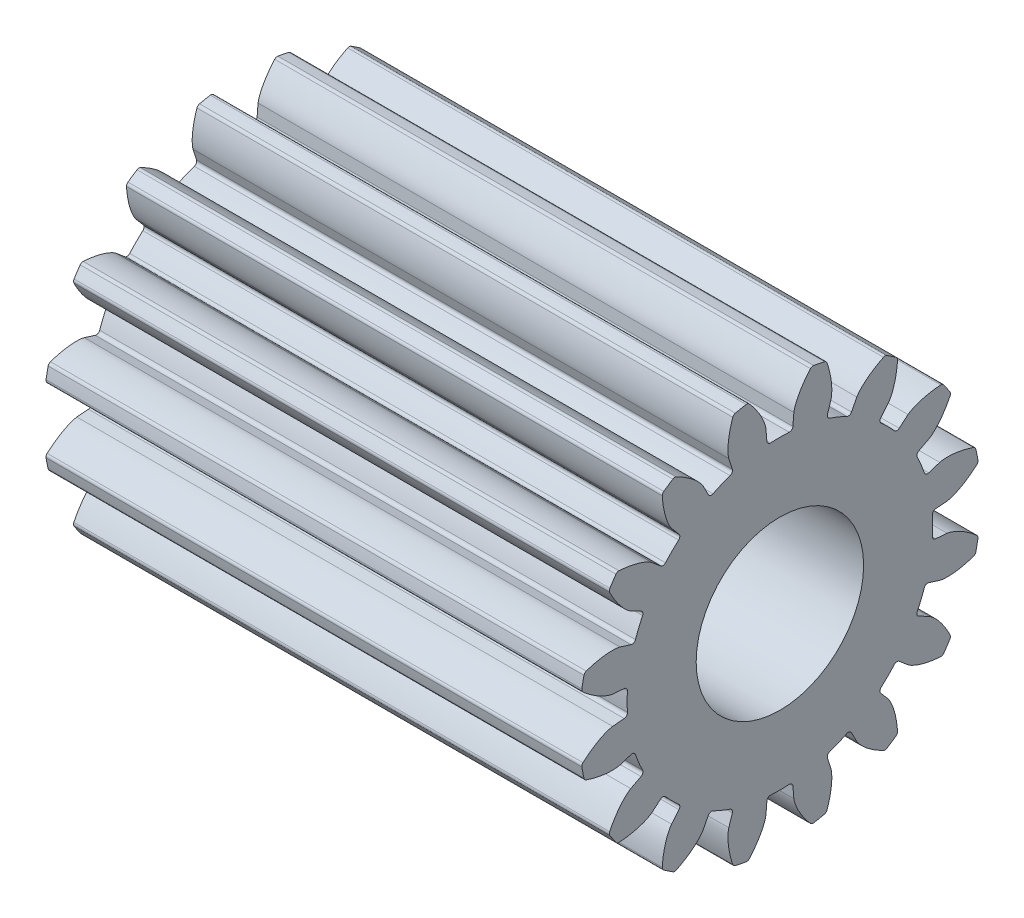
from build123d import *

# Parameters (mm, degrees)
SKETCH2_R                      = 9.525
SKETCH2_R_2                    = 3.96875
GEAR_WIDTH_EXTRUDE_DEPTH       = 25.4
GEAR_TOOTH_CUT_DEPTH           = 25.4
TOOTH_FILLETS_R                = 0.166158333
CIRPATTERN1_COUNT              = 16
CIRPATTERN1_COPY_1_DEPTH       = 25.4
CIRPATTERN1_COPY_2_DEPTH       = 25.4
CIRPATTERN1_COPY_3_DEPTH       = 25.4
CIRPATTERN1_COPY_4_DEPTH       = 25.4
CIRPATTERN1_COPY_5_DEPTH       = 25.4
CIRPATTERN1_COPY_6_DEPTH       = 25.4
CIRPATTERN1_COPY_7_DEPTH       = 25.4
CIRPATTERN1_COPY_8_DEPTH       = 25.4
CIRPATTERN1_COPY_9_DEPTH       = 25.4
CIRPATTERN1_COPY_10_DEPTH      = 25.4
CIRPATTERN1_COPY_11_DEPTH      = 25.4
CIRPATTERN1_COPY_12_DEPTH      = 25.4
CIRPATTERN1_COPY_13_DEPTH      = 25.4
CIRPATTERN1_COPY_14_DEPTH      = 25.4
CIRPATTERN1_COPY_15_DEPTH      = 25.4
TOOTH_FILLETS_OF_CIRPATTERN1_R = 0.166158333


with BuildPart() as part:
    # Sketch2 → Gear Width Extrude (new body)
    with BuildSketch(Plane.YZ):
        Circle(SKETCH2_R)
        Circle(SKETCH2_R_2, mode=Mode.SUBTRACT)
    extrude(amount=GEAR_WIDTH_EXTRUDE_DEPTH)

    # Sketch3 → Gear Tooth Cut (cut)
    with BuildSketch(Plane.YZ):
        with BuildLine():
            ThreePointArc((7.217081039, 0.602362023), (7.23589879, 0.301442247), (7.242175, 0))
            Line((7.242175, 0), (9.525, 0))
            ThreePointArc((9.525, 0), (9.494777011, 0.758178416), (9.40429984, 1.511545405))
            add(Edge.make_bspline(
                [(7.92849662, 0.661739176), (7.931033412, 0.661986521), (7.938137755, 0.662789667), (7.960006234, 0.665975561), (8.00289467, 0.674240792), (8.055417038, 0.687277699), (8.115325958, 0.704960105), (8.172704771, 0.724134336), (8.221473162, 0.74183102), (8.269833879, 0.760691719), (8.317737193, 0.780565767), (8.375423353, 0.805916371), (8.444109409, 0.838085472), (8.523635746, 0.878248138), (8.612898724, 0.926808518), (8.702807913, 0.979487909), (8.790380894, 1.033935241), (8.877764367, 1.091915859), (8.961530307, 1.150117227), (9.047335874, 1.213569409), (9.125932899, 1.273668216), (9.212588483, 1.34427632), (9.282116998, 1.402218266), (9.352724099, 1.464773247), (9.386907426, 1.495616144), (9.40429984, 1.511545405)],
                knots=[0, 0, 0, 0, 0, 0.005376749, 0.015083688, 0.04661014, 0.092110526, 0.119476176, 0.146842496, 0.174208854, 0.201574956, 0.228941013, 0.256307345, 0.307035032, 0.361767352, 0.416499661, 0.471231937, 0.525964282, 0.580696616, 0.635428982, 0.690161387, 0.744893688, 0.799626082, 0.854358408, 0.909090915, 0.909090915, 0.909090915, 0.909090915, 0.909090915], degree=4))
            Line((7.92849662, 0.661739176), (7.217081039, 0.602362023))
        make_face()
    gear_tooth_cut = extrude(amount=GEAR_TOOTH_CUT_DEPTH, mode=Mode.SUBTRACT)

    # Gear Tooth Cut Mirror: Gear Tooth Cut across plane
    add(gear_tooth_cut.mirror(Plane(origin=(25.4, 0, 0), x_dir=(1, 0, 0), z_dir=(0, 0, 1))), mode=Mode.SUBTRACT)

    # Tooth Fillets
    tooth_fillets_edges = [part.edges().sort_by_distance(p)[0] for p in [
        (12.7, 9.40429984, 1.511545405),
        (12.7, 9.40429984, -1.511545405),
        (12.7, 7.217081039, 0.602362023),
        (12.7, 7.217081039, -0.602362023),
    ]]
    fillet(tooth_fillets_edges, radius=TOOTH_FILLETS_R)

    # CirPattern1: Gear Tooth Cut ×16 about axis
    cirpattern1_axis = Axis((0, 0, 0), (1, 0, 0))
    for i in range(1, CIRPATTERN1_COUNT):
        add(gear_tooth_cut.rotate(cirpattern1_axis, i * 360 / CIRPATTERN1_COUNT), mode=Mode.SUBTRACT)

    # CirPattern1 copy 1 sketch → CirPattern1 copy 1 (cut)
    with BuildSketch(Plane(origin=(0, 0, 0), x_dir=(0, 0.9238795325112867, 0.3826834323650898), z_dir=(1, 0, 0))):
        with BuildLine():
            ThreePointArc((7.217081039, -0.602362023), (7.23589879, -0.301442247), (7.242175, 0))
            Line((7.242175, 0), (9.525, 0))
            ThreePointArc((9.525, 0), (9.494777011, -0.758178416), (9.40429984, -1.511545405))
            add(Edge.make_bspline(
                [(7.92849662, -0.661739176), (7.931033412, -0.661986521), (7.938137755, -0.662789667), (7.960006234, -0.665975561), (8.00289467, -0.674240792), (8.055417038, -0.687277699), (8.115325958, -0.704960105), (8.172704771, -0.724134336), (8.221473162, -0.74183102), (8.269833879, -0.760691719), (8.317737193, -0.780565767), (8.375423353, -0.805916371), (8.444109409, -0.838085472), (8.523635746, -0.878248138), (8.612898724, -0.926808518), (8.702807913, -0.979487909), (8.790380894, -1.033935241), (8.877764367, -1.091915859), (8.961530307, -1.150117227), (9.047335874, -1.213569409), (9.125932899, -1.273668216), (9.212588483, -1.34427632), (9.282116998, -1.402218266), (9.352724099, -1.464773247), (9.386907426, -1.495616144), (9.40429984, -1.511545405)],
                knots=[0, 0, 0, 0, 0, 0.005376749, 0.015083688, 0.04661014, 0.092110526, 0.119476176, 0.146842496, 0.174208854, 0.201574956, 0.228941013, 0.256307345, 0.307035032, 0.361767352, 0.416499661, 0.471231937, 0.525964282, 0.580696616, 0.635428982, 0.690161387, 0.744893688, 0.799626082, 0.854358408, 0.909090915, 0.909090915, 0.909090915, 0.909090915, 0.909090915], degree=4))
            Line((7.92849662, -0.661739176), (7.217081039, -0.602362023))
        make_face()
    extrude(amount=CIRPATTERN1_COPY_1_DEPTH, mode=Mode.SUBTRACT)

    # CirPattern1 copy 2 sketch → CirPattern1 copy 2 (cut)
    with BuildSketch(Plane(origin=(0, 0, 0), x_dir=(0, 0.7071067811865476, 0.7071067811865475), z_dir=(1, 0, 0))):
        with BuildLine():
            ThreePointArc((7.217081039, -0.602362023), (7.23589879, -0.301442247), (7.242175, 0))
            Line((7.242175, 0), (9.525, 0))
            ThreePointArc((9.525, 0), (9.494777011, -0.758178416), (9.40429984, -1.511545405))
            add(Edge.make_bspline(
                [(7.92849662, -0.661739176), (7.931033412, -0.661986521), (7.938137755, -0.662789667), (7.960006234, -0.665975561), (8.00289467, -0.674240792), (8.055417038, -0.687277699), (8.115325958, -0.704960105), (8.172704771, -0.724134336), (8.221473162, -0.74183102), (8.269833879, -0.760691719), (8.317737193, -0.780565767), (8.375423353, -0.805916371), (8.444109409, -0.838085472), (8.523635746, -0.878248138), (8.612898724, -0.926808518), (8.702807913, -0.979487909), (8.790380894, -1.033935241), (8.877764367, -1.091915859), (8.961530307, -1.150117227), (9.047335874, -1.213569409), (9.125932899, -1.273668216), (9.212588483, -1.34427632), (9.282116998, -1.402218266), (9.352724099, -1.464773247), (9.386907426, -1.495616144), (9.40429984, -1.511545405)],
                knots=[0, 0, 0, 0, 0, 0.005376749, 0.015083688, 0.04661014, 0.092110526, 0.119476176, 0.146842496, 0.174208854, 0.201574956, 0.228941013, 0.256307345, 0.307035032, 0.361767352, 0.416499661, 0.471231937, 0.525964282, 0.580696616, 0.635428982, 0.690161387, 0.744893688, 0.799626082, 0.854358408, 0.909090915, 0.909090915, 0.909090915, 0.909090915, 0.909090915], degree=4))
            Line((7.92849662, -0.661739176), (7.217081039, -0.602362023))
        make_face()
    extrude(amount=CIRPATTERN1_COPY_2_DEPTH, mode=Mode.SUBTRACT)

    # CirPattern1 copy 3 sketch → CirPattern1 copy 3 (cut)
    with BuildSketch(Plane(origin=(0, 0, 0), x_dir=(0, 0.38268343236508984, 0.9238795325112867), z_dir=(1, 0, 0))):
        with BuildLine():
            ThreePointArc((7.217081039, -0.602362023), (7.23589879, -0.301442247), (7.242175, 0))
            Line((7.242175, 0), (9.525, 0))
            ThreePointArc((9.525, 0), (9.494777011, -0.758178416), (9.40429984, -1.511545405))
            add(Edge.make_bspline(
                [(7.92849662, -0.661739176), (7.931033412, -0.661986521), (7.938137755, -0.662789667), (7.960006234, -0.665975561), (8.00289467, -0.674240792), (8.055417038, -0.687277699), (8.115325958, -0.704960105), (8.172704771, -0.724134336), (8.221473162, -0.74183102), (8.269833879, -0.760691719), (8.317737193, -0.780565767), (8.375423353, -0.805916371), (8.444109409, -0.838085472), (8.523635746, -0.878248138), (8.612898724, -0.926808518), (8.702807913, -0.979487909), (8.790380894, -1.033935241), (8.877764367, -1.091915859), (8.961530307, -1.150117227), (9.047335874, -1.213569409), (9.125932899, -1.273668216), (9.212588483, -1.34427632), (9.282116998, -1.402218266), (9.352724099, -1.464773247), (9.386907426, -1.495616144), (9.40429984, -1.511545405)],
                knots=[0, 0, 0, 0, 0, 0.005376749, 0.015083688, 0.04661014, 0.092110526, 0.119476176, 0.146842496, 0.174208854, 0.201574956, 0.228941013, 0.256307345, 0.307035032, 0.361767352, 0.416499661, 0.471231937, 0.525964282, 0.580696616, 0.635428982, 0.690161387, 0.744893688, 0.799626082, 0.854358408, 0.909090915, 0.909090915, 0.909090915, 0.909090915, 0.909090915], degree=4))
            Line((7.92849662, -0.661739176), (7.217081039, -0.602362023))
        make_face()
    extrude(amount=CIRPATTERN1_COPY_3_DEPTH, mode=Mode.SUBTRACT)

    # CirPattern1 copy 4 sketch → CirPattern1 copy 4 (cut)
    with BuildSketch(Plane(origin=(0, 0, 0), x_dir=(0, 0, 1), z_dir=(1, 0, 0))):
        with BuildLine():
            ThreePointArc((7.217081039, -0.602362023), (7.23589879, -0.301442247), (7.242175, 0))
            Line((7.242175, 0), (9.525, 0))
            ThreePointArc((9.525, 0), (9.494777011, -0.758178416), (9.40429984, -1.511545405))
            add(Edge.make_bspline(
                [(7.92849662, -0.661739176), (7.931033412, -0.661986521), (7.938137755, -0.662789667), (7.960006234, -0.665975561), (8.00289467, -0.674240792), (8.055417038, -0.687277699), (8.115325958, -0.704960105), (8.172704771, -0.724134336), (8.221473162, -0.74183102), (8.269833879, -0.760691719), (8.317737193, -0.780565767), (8.375423353, -0.805916371), (8.444109409, -0.838085472), (8.523635746, -0.878248138), (8.612898724, -0.926808518), (8.702807913, -0.979487909), (8.790380894, -1.033935241), (8.877764367, -1.091915859), (8.961530307, -1.150117227), (9.047335874, -1.213569409), (9.125932899, -1.273668216), (9.212588483, -1.34427632), (9.282116998, -1.402218266), (9.352724099, -1.464773247), (9.386907426, -1.495616144), (9.40429984, -1.511545405)],
                knots=[0, 0, 0, 0, 0, 0.005376749, 0.015083688, 0.04661014, 0.092110526, 0.119476176, 0.146842496, 0.174208854, 0.201574956, 0.228941013, 0.256307345, 0.307035032, 0.361767352, 0.416499661, 0.471231937, 0.525964282, 0.580696616, 0.635428982, 0.690161387, 0.744893688, 0.799626082, 0.854358408, 0.909090915, 0.909090915, 0.909090915, 0.909090915, 0.909090915], degree=4))
            Line((7.92849662, -0.661739176), (7.217081039, -0.602362023))
        make_face()
    extrude(amount=CIRPATTERN1_COPY_4_DEPTH, mode=Mode.SUBTRACT)

    # CirPattern1 copy 5 sketch → CirPattern1 copy 5 (cut)
    with BuildSketch(Plane(origin=(0, 0, 0), x_dir=(0, -0.3826834323650897, 0.9238795325112867), z_dir=(1, 0, 0))):
        with BuildLine():
            ThreePointArc((7.217081039, -0.602362023), (7.23589879, -0.301442247), (7.242175, 0))
            Line((7.242175, 0), (9.525, 0))
            ThreePointArc((9.525, 0), (9.494777011, -0.758178416), (9.40429984, -1.511545405))
            add(Edge.make_bspline(
                [(7.92849662, -0.661739176), (7.931033412, -0.661986521), (7.938137755, -0.662789667), (7.960006234, -0.665975561), (8.00289467, -0.674240792), (8.055417038, -0.687277699), (8.115325958, -0.704960105), (8.172704771, -0.724134336), (8.221473162, -0.74183102), (8.269833879, -0.760691719), (8.317737193, -0.780565767), (8.375423353, -0.805916371), (8.444109409, -0.838085472), (8.523635746, -0.878248138), (8.612898724, -0.926808518), (8.702807913, -0.979487909), (8.790380894, -1.033935241), (8.877764367, -1.091915859), (8.961530307, -1.150117227), (9.047335874, -1.213569409), (9.125932899, -1.273668216), (9.212588483, -1.34427632), (9.282116998, -1.402218266), (9.352724099, -1.464773247), (9.386907426, -1.495616144), (9.40429984, -1.511545405)],
                knots=[0, 0, 0, 0, 0, 0.005376749, 0.015083688, 0.04661014, 0.092110526, 0.119476176, 0.146842496, 0.174208854, 0.201574956, 0.228941013, 0.256307345, 0.307035032, 0.361767352, 0.416499661, 0.471231937, 0.525964282, 0.580696616, 0.635428982, 0.690161387, 0.744893688, 0.799626082, 0.854358408, 0.909090915, 0.909090915, 0.909090915, 0.909090915, 0.909090915], degree=4))
            Line((7.92849662, -0.661739176), (7.217081039, -0.602362023))
        make_face()
    extrude(amount=CIRPATTERN1_COPY_5_DEPTH, mode=Mode.SUBTRACT)

    # CirPattern1 copy 6 sketch → CirPattern1 copy 6 (cut)
    with BuildSketch(Plane(origin=(0, 0, 0), x_dir=(0, -0.7071067811865475, 0.7071067811865476), z_dir=(1, 0, 0))):
        with BuildLine():
            ThreePointArc((7.217081039, -0.602362023), (7.23589879, -0.301442247), (7.242175, 0))
            Line((7.242175, 0), (9.525, 0))
            ThreePointArc((9.525, 0), (9.494777011, -0.758178416), (9.40429984, -1.511545405))
            add(Edge.make_bspline(
                [(7.92849662, -0.661739176), (7.931033412, -0.661986521), (7.938137755, -0.662789667), (7.960006234, -0.665975561), (8.00289467, -0.674240792), (8.055417038, -0.687277699), (8.115325958, -0.704960105), (8.172704771, -0.724134336), (8.221473162, -0.74183102), (8.269833879, -0.760691719), (8.317737193, -0.780565767), (8.375423353, -0.805916371), (8.444109409, -0.838085472), (8.523635746, -0.878248138), (8.612898724, -0.926808518), (8.702807913, -0.979487909), (8.790380894, -1.033935241), (8.877764367, -1.091915859), (8.961530307, -1.150117227), (9.047335874, -1.213569409), (9.125932899, -1.273668216), (9.212588483, -1.34427632), (9.282116998, -1.402218266), (9.352724099, -1.464773247), (9.386907426, -1.495616144), (9.40429984, -1.511545405)],
                knots=[0, 0, 0, 0, 0, 0.005376749, 0.015083688, 0.04661014, 0.092110526, 0.119476176, 0.146842496, 0.174208854, 0.201574956, 0.228941013, 0.256307345, 0.307035032, 0.361767352, 0.416499661, 0.471231937, 0.525964282, 0.580696616, 0.635428982, 0.690161387, 0.744893688, 0.799626082, 0.854358408, 0.909090915, 0.909090915, 0.909090915, 0.909090915, 0.909090915], degree=4))
            Line((7.92849662, -0.661739176), (7.217081039, -0.602362023))
        make_face()
    extrude(amount=CIRPATTERN1_COPY_6_DEPTH, mode=Mode.SUBTRACT)

    # CirPattern1 copy 7 sketch → CirPattern1 copy 7 (cut)
    with BuildSketch(Plane(origin=(0, 0, 0), x_dir=(0, -0.9238795325112867, 0.3826834323650899), z_dir=(1, 0, 0))):
        with BuildLine():
            ThreePointArc((7.217081039, -0.602362023), (7.23589879, -0.301442247), (7.242175, 0))
            Line((7.242175, 0), (9.525, 0))
            ThreePointArc((9.525, 0), (9.494777011, -0.758178416), (9.40429984, -1.511545405))
            add(Edge.make_bspline(
                [(7.92849662, -0.661739176), (7.931033412, -0.661986521), (7.938137755, -0.662789667), (7.960006234, -0.665975561), (8.00289467, -0.674240792), (8.055417038, -0.687277699), (8.115325958, -0.704960105), (8.172704771, -0.724134336), (8.221473162, -0.74183102), (8.269833879, -0.760691719), (8.317737193, -0.780565767), (8.375423353, -0.805916371), (8.444109409, -0.838085472), (8.523635746, -0.878248138), (8.612898724, -0.926808518), (8.702807913, -0.979487909), (8.790380894, -1.033935241), (8.877764367, -1.091915859), (8.961530307, -1.150117227), (9.047335874, -1.213569409), (9.125932899, -1.273668216), (9.212588483, -1.34427632), (9.282116998, -1.402218266), (9.352724099, -1.464773247), (9.386907426, -1.495616144), (9.40429984, -1.511545405)],
                knots=[0, 0, 0, 0, 0, 0.005376749, 0.015083688, 0.04661014, 0.092110526, 0.119476176, 0.146842496, 0.174208854, 0.201574956, 0.228941013, 0.256307345, 0.307035032, 0.361767352, 0.416499661, 0.471231937, 0.525964282, 0.580696616, 0.635428982, 0.690161387, 0.744893688, 0.799626082, 0.854358408, 0.909090915, 0.909090915, 0.909090915, 0.909090915, 0.909090915], degree=4))
            Line((7.92849662, -0.661739176), (7.217081039, -0.602362023))
        make_face()
    extrude(amount=CIRPATTERN1_COPY_7_DEPTH, mode=Mode.SUBTRACT)

    # CirPattern1 copy 8 sketch → CirPattern1 copy 8 (cut)
    with BuildSketch(Plane(origin=(0, 0, 0), x_dir=(0, -1, 0), z_dir=(1, 0, 0))):
        with BuildLine():
            ThreePointArc((7.217081039, -0.602362023), (7.23589879, -0.301442247), (7.242175, 0))
            Line((7.242175, 0), (9.525, 0))
            ThreePointArc((9.525, 0), (9.494777011, -0.758178416), (9.40429984, -1.511545405))
            add(Edge.make_bspline(
                [(7.92849662, -0.661739176), (7.931033412, -0.661986521), (7.938137755, -0.662789667), (7.960006234, -0.665975561), (8.00289467, -0.674240792), (8.055417038, -0.687277699), (8.115325958, -0.704960105), (8.172704771, -0.724134336), (8.221473162, -0.74183102), (8.269833879, -0.760691719), (8.317737193, -0.780565767), (8.375423353, -0.805916371), (8.444109409, -0.838085472), (8.523635746, -0.878248138), (8.612898724, -0.926808518), (8.702807913, -0.979487909), (8.790380894, -1.033935241), (8.877764367, -1.091915859), (8.961530307, -1.150117227), (9.047335874, -1.213569409), (9.125932899, -1.273668216), (9.212588483, -1.34427632), (9.282116998, -1.402218266), (9.352724099, -1.464773247), (9.386907426, -1.495616144), (9.40429984, -1.511545405)],
                knots=[0, 0, 0, 0, 0, 0.005376749, 0.015083688, 0.04661014, 0.092110526, 0.119476176, 0.146842496, 0.174208854, 0.201574956, 0.228941013, 0.256307345, 0.307035032, 0.361767352, 0.416499661, 0.471231937, 0.525964282, 0.580696616, 0.635428982, 0.690161387, 0.744893688, 0.799626082, 0.854358408, 0.909090915, 0.909090915, 0.909090915, 0.909090915, 0.909090915], degree=4))
            Line((7.92849662, -0.661739176), (7.217081039, -0.602362023))
        make_face()
    extrude(amount=CIRPATTERN1_COPY_8_DEPTH, mode=Mode.SUBTRACT)

    # CirPattern1 copy 9 sketch → CirPattern1 copy 9 (cut)
    with BuildSketch(Plane(origin=(0, 0, 0), x_dir=(0, -0.9238795325112868, -0.38268343236508967), z_dir=(1, 0, 0))):
        with BuildLine():
            ThreePointArc((7.217081039, -0.602362023), (7.23589879, -0.301442247), (7.242175, 0))
            Line((7.242175, 0), (9.525, 0))
            ThreePointArc((9.525, 0), (9.494777011, -0.758178416), (9.40429984, -1.511545405))
            add(Edge.make_bspline(
                [(7.92849662, -0.661739176), (7.931033412, -0.661986521), (7.938137755, -0.662789667), (7.960006234, -0.665975561), (8.00289467, -0.674240792), (8.055417038, -0.687277699), (8.115325958, -0.704960105), (8.172704771, -0.724134336), (8.221473162, -0.74183102), (8.269833879, -0.760691719), (8.317737193, -0.780565767), (8.375423353, -0.805916371), (8.444109409, -0.838085472), (8.523635746, -0.878248138), (8.612898724, -0.926808518), (8.702807913, -0.979487909), (8.790380894, -1.033935241), (8.877764367, -1.091915859), (8.961530307, -1.150117227), (9.047335874, -1.213569409), (9.125932899, -1.273668216), (9.212588483, -1.34427632), (9.282116998, -1.402218266), (9.352724099, -1.464773247), (9.386907426, -1.495616144), (9.40429984, -1.511545405)],
                knots=[0, 0, 0, 0, 0, 0.005376749, 0.015083688, 0.04661014, 0.092110526, 0.119476176, 0.146842496, 0.174208854, 0.201574956, 0.228941013, 0.256307345, 0.307035032, 0.361767352, 0.416499661, 0.471231937, 0.525964282, 0.580696616, 0.635428982, 0.690161387, 0.744893688, 0.799626082, 0.854358408, 0.909090915, 0.909090915, 0.909090915, 0.909090915, 0.909090915], degree=4))
            Line((7.92849662, -0.661739176), (7.217081039, -0.602362023))
        make_face()
    extrude(amount=CIRPATTERN1_COPY_9_DEPTH, mode=Mode.SUBTRACT)

    # CirPattern1 copy 10 sketch → CirPattern1 copy 10 (cut)
    with BuildSketch(Plane(origin=(0, 0, 0), x_dir=(0, -0.7071067811865477, -0.7071067811865475), z_dir=(1, 0, 0))):
        with BuildLine():
            ThreePointArc((7.217081039, -0.602362023), (7.23589879, -0.301442247), (7.242175, 0))
            Line((7.242175, 0), (9.525, 0))
            ThreePointArc((9.525, 0), (9.494777011, -0.758178416), (9.40429984, -1.511545405))
            add(Edge.make_bspline(
                [(7.92849662, -0.661739176), (7.931033412, -0.661986521), (7.938137755, -0.662789667), (7.960006234, -0.665975561), (8.00289467, -0.674240792), (8.055417038, -0.687277699), (8.115325958, -0.704960105), (8.172704771, -0.724134336), (8.221473162, -0.74183102), (8.269833879, -0.760691719), (8.317737193, -0.780565767), (8.375423353, -0.805916371), (8.444109409, -0.838085472), (8.523635746, -0.878248138), (8.612898724, -0.926808518), (8.702807913, -0.979487909), (8.790380894, -1.033935241), (8.877764367, -1.091915859), (8.961530307, -1.150117227), (9.047335874, -1.213569409), (9.125932899, -1.273668216), (9.212588483, -1.34427632), (9.282116998, -1.402218266), (9.352724099, -1.464773247), (9.386907426, -1.495616144), (9.40429984, -1.511545405)],
                knots=[0, 0, 0, 0, 0, 0.005376749, 0.015083688, 0.04661014, 0.092110526, 0.119476176, 0.146842496, 0.174208854, 0.201574956, 0.228941013, 0.256307345, 0.307035032, 0.361767352, 0.416499661, 0.471231937, 0.525964282, 0.580696616, 0.635428982, 0.690161387, 0.744893688, 0.799626082, 0.854358408, 0.909090915, 0.909090915, 0.909090915, 0.909090915, 0.909090915], degree=4))
            Line((7.92849662, -0.661739176), (7.217081039, -0.602362023))
        make_face()
    extrude(amount=CIRPATTERN1_COPY_10_DEPTH, mode=Mode.SUBTRACT)

    # CirPattern1 copy 11 sketch → CirPattern1 copy 11 (cut)
    with BuildSketch(Plane(origin=(0, 0, 0), x_dir=(0, -0.3826834323650895, -0.9238795325112868), z_dir=(1, 0, 0))):
        with BuildLine():
            ThreePointArc((7.217081039, -0.602362023), (7.23589879, -0.301442247), (7.242175, 0))
            Line((7.242175, 0), (9.525, 0))
            ThreePointArc((9.525, 0), (9.494777011, -0.758178416), (9.40429984, -1.511545405))
            add(Edge.make_bspline(
                [(7.92849662, -0.661739176), (7.931033412, -0.661986521), (7.938137755, -0.662789667), (7.960006234, -0.665975561), (8.00289467, -0.674240792), (8.055417038, -0.687277699), (8.115325958, -0.704960105), (8.172704771, -0.724134336), (8.221473162, -0.74183102), (8.269833879, -0.760691719), (8.317737193, -0.780565767), (8.375423353, -0.805916371), (8.444109409, -0.838085472), (8.523635746, -0.878248138), (8.612898724, -0.926808518), (8.702807913, -0.979487909), (8.790380894, -1.033935241), (8.877764367, -1.091915859), (8.961530307, -1.150117227), (9.047335874, -1.213569409), (9.125932899, -1.273668216), (9.212588483, -1.34427632), (9.282116998, -1.402218266), (9.352724099, -1.464773247), (9.386907426, -1.495616144), (9.40429984, -1.511545405)],
                knots=[0, 0, 0, 0, 0, 0.005376749, 0.015083688, 0.04661014, 0.092110526, 0.119476176, 0.146842496, 0.174208854, 0.201574956, 0.228941013, 0.256307345, 0.307035032, 0.361767352, 0.416499661, 0.471231937, 0.525964282, 0.580696616, 0.635428982, 0.690161387, 0.744893688, 0.799626082, 0.854358408, 0.909090915, 0.909090915, 0.909090915, 0.909090915, 0.909090915], degree=4))
            Line((7.92849662, -0.661739176), (7.217081039, -0.602362023))
        make_face()
    extrude(amount=CIRPATTERN1_COPY_11_DEPTH, mode=Mode.SUBTRACT)

    # CirPattern1 copy 12 sketch → CirPattern1 copy 12 (cut)
    with BuildSketch(Plane(origin=(0, 0, 0), x_dir=(0, 0, -1), z_dir=(1, 0, 0))):
        with BuildLine():
            ThreePointArc((7.217081039, -0.602362023), (7.23589879, -0.301442247), (7.242175, 0))
            Line((7.242175, 0), (9.525, 0))
            ThreePointArc((9.525, 0), (9.494777011, -0.758178416), (9.40429984, -1.511545405))
            add(Edge.make_bspline(
                [(7.92849662, -0.661739176), (7.931033412, -0.661986521), (7.938137755, -0.662789667), (7.960006234, -0.665975561), (8.00289467, -0.674240792), (8.055417038, -0.687277699), (8.115325958, -0.704960105), (8.172704771, -0.724134336), (8.221473162, -0.74183102), (8.269833879, -0.760691719), (8.317737193, -0.780565767), (8.375423353, -0.805916371), (8.444109409, -0.838085472), (8.523635746, -0.878248138), (8.612898724, -0.926808518), (8.702807913, -0.979487909), (8.790380894, -1.033935241), (8.877764367, -1.091915859), (8.961530307, -1.150117227), (9.047335874, -1.213569409), (9.125932899, -1.273668216), (9.212588483, -1.34427632), (9.282116998, -1.402218266), (9.352724099, -1.464773247), (9.386907426, -1.495616144), (9.40429984, -1.511545405)],
                knots=[0, 0, 0, 0, 0, 0.005376749, 0.015083688, 0.04661014, 0.092110526, 0.119476176, 0.146842496, 0.174208854, 0.201574956, 0.228941013, 0.256307345, 0.307035032, 0.361767352, 0.416499661, 0.471231937, 0.525964282, 0.580696616, 0.635428982, 0.690161387, 0.744893688, 0.799626082, 0.854358408, 0.909090915, 0.909090915, 0.909090915, 0.909090915, 0.909090915], degree=4))
            Line((7.92849662, -0.661739176), (7.217081039, -0.602362023))
        make_face()
    extrude(amount=CIRPATTERN1_COPY_12_DEPTH, mode=Mode.SUBTRACT)

    # CirPattern1 copy 13 sketch → CirPattern1 copy 13 (cut)
    with BuildSketch(Plane(origin=(0, 0, 0), x_dir=(0, 0.38268343236509, -0.9238795325112866), z_dir=(1, 0, 0))):
        with BuildLine():
            ThreePointArc((7.217081039, -0.602362023), (7.23589879, -0.301442247), (7.242175, 0))
            Line((7.242175, 0), (9.525, 0))
            ThreePointArc((9.525, 0), (9.494777011, -0.758178416), (9.40429984, -1.511545405))
            add(Edge.make_bspline(
                [(7.92849662, -0.661739176), (7.931033412, -0.661986521), (7.938137755, -0.662789667), (7.960006234, -0.665975561), (8.00289467, -0.674240792), (8.055417038, -0.687277699), (8.115325958, -0.704960105), (8.172704771, -0.724134336), (8.221473162, -0.74183102), (8.269833879, -0.760691719), (8.317737193, -0.780565767), (8.375423353, -0.805916371), (8.444109409, -0.838085472), (8.523635746, -0.878248138), (8.612898724, -0.926808518), (8.702807913, -0.979487909), (8.790380894, -1.033935241), (8.877764367, -1.091915859), (8.961530307, -1.150117227), (9.047335874, -1.213569409), (9.125932899, -1.273668216), (9.212588483, -1.34427632), (9.282116998, -1.402218266), (9.352724099, -1.464773247), (9.386907426, -1.495616144), (9.40429984, -1.511545405)],
                knots=[0, 0, 0, 0, 0, 0.005376749, 0.015083688, 0.04661014, 0.092110526, 0.119476176, 0.146842496, 0.174208854, 0.201574956, 0.228941013, 0.256307345, 0.307035032, 0.361767352, 0.416499661, 0.471231937, 0.525964282, 0.580696616, 0.635428982, 0.690161387, 0.744893688, 0.799626082, 0.854358408, 0.909090915, 0.909090915, 0.909090915, 0.909090915, 0.909090915], degree=4))
            Line((7.92849662, -0.661739176), (7.217081039, -0.602362023))
        make_face()
    extrude(amount=CIRPATTERN1_COPY_13_DEPTH, mode=Mode.SUBTRACT)

    # CirPattern1 copy 14 sketch → CirPattern1 copy 14 (cut)
    with BuildSketch(Plane(origin=(0, 0, 0), x_dir=(0, 0.7071067811865474, -0.7071067811865477), z_dir=(1, 0, 0))):
        with BuildLine():
            ThreePointArc((7.217081039, -0.602362023), (7.23589879, -0.301442247), (7.242175, 0))
            Line((7.242175, 0), (9.525, 0))
            ThreePointArc((9.525, 0), (9.494777011, -0.758178416), (9.40429984, -1.511545405))
            add(Edge.make_bspline(
                [(7.92849662, -0.661739176), (7.931033412, -0.661986521), (7.938137755, -0.662789667), (7.960006234, -0.665975561), (8.00289467, -0.674240792), (8.055417038, -0.687277699), (8.115325958, -0.704960105), (8.172704771, -0.724134336), (8.221473162, -0.74183102), (8.269833879, -0.760691719), (8.317737193, -0.780565767), (8.375423353, -0.805916371), (8.444109409, -0.838085472), (8.523635746, -0.878248138), (8.612898724, -0.926808518), (8.702807913, -0.979487909), (8.790380894, -1.033935241), (8.877764367, -1.091915859), (8.961530307, -1.150117227), (9.047335874, -1.213569409), (9.125932899, -1.273668216), (9.212588483, -1.34427632), (9.282116998, -1.402218266), (9.352724099, -1.464773247), (9.386907426, -1.495616144), (9.40429984, -1.511545405)],
                knots=[0, 0, 0, 0, 0, 0.005376749, 0.015083688, 0.04661014, 0.092110526, 0.119476176, 0.146842496, 0.174208854, 0.201574956, 0.228941013, 0.256307345, 0.307035032, 0.361767352, 0.416499661, 0.471231937, 0.525964282, 0.580696616, 0.635428982, 0.690161387, 0.744893688, 0.799626082, 0.854358408, 0.909090915, 0.909090915, 0.909090915, 0.909090915, 0.909090915], degree=4))
            Line((7.92849662, -0.661739176), (7.217081039, -0.602362023))
        make_face()
    extrude(amount=CIRPATTERN1_COPY_14_DEPTH, mode=Mode.SUBTRACT)

    # CirPattern1 copy 15 sketch → CirPattern1 copy 15 (cut)
    with BuildSketch(Plane(origin=(0, 0, 0), x_dir=(0, 0.9238795325112868, -0.38268343236508956), z_dir=(1, 0, 0))):
        with BuildLine():
            ThreePointArc((7.217081039, -0.602362023), (7.23589879, -0.301442247), (7.242175, 0))
            Line((7.242175, 0), (9.525, 0))
            ThreePointArc((9.525, 0), (9.494777011, -0.758178416), (9.40429984, -1.511545405))
            add(Edge.make_bspline(
                [(7.92849662, -0.661739176), (7.931033412, -0.661986521), (7.938137755, -0.662789667), (7.960006234, -0.665975561), (8.00289467, -0.674240792), (8.055417038, -0.687277699), (8.115325958, -0.704960105), (8.172704771, -0.724134336), (8.221473162, -0.74183102), (8.269833879, -0.760691719), (8.317737193, -0.780565767), (8.375423353, -0.805916371), (8.444109409, -0.838085472), (8.523635746, -0.878248138), (8.612898724, -0.926808518), (8.702807913, -0.979487909), (8.790380894, -1.033935241), (8.877764367, -1.091915859), (8.961530307, -1.150117227), (9.047335874, -1.213569409), (9.125932899, -1.273668216), (9.212588483, -1.34427632), (9.282116998, -1.402218266), (9.352724099, -1.464773247), (9.386907426, -1.495616144), (9.40429984, -1.511545405)],
                knots=[0, 0, 0, 0, 0, 0.005376749, 0.015083688, 0.04661014, 0.092110526, 0.119476176, 0.146842496, 0.174208854, 0.201574956, 0.228941013, 0.256307345, 0.307035032, 0.361767352, 0.416499661, 0.471231937, 0.525964282, 0.580696616, 0.635428982, 0.690161387, 0.744893688, 0.799626082, 0.854358408, 0.909090915, 0.909090915, 0.909090915, 0.909090915, 0.909090915], degree=4))
            Line((7.92849662, -0.661739176), (7.217081039, -0.602362023))
        make_face()
    extrude(amount=CIRPATTERN1_COPY_15_DEPTH, mode=Mode.SUBTRACT)

    # Tooth Fillets of CirPattern1
    tooth_fillets_of_cirpattern1_edges = [part.edges().sort_by_distance(p)[0] for p in [
        (12.7, 8.109996756, 4.995355604),
        (12.7, 9.266883524, 2.20238388),
        (12.7, 6.43719949, 3.318367288),
        (12.7, 6.898227423, 2.2053474),
        (12.7, 5.581020183, 7.718668196),
        (12.7, 7.718668196, 5.581020183),
        (12.7, 4.677312672, 5.529181214),
        (12.7, 5.529181214, 4.677312672),
        (12.7, 2.20238388, 9.266883524),
        (12.7, 4.995355604, 8.109996756),
        (12.7, 2.2053474, 6.898227423),
        (12.7, 3.318367288, 6.43719949),
        (12.7, -1.511545405, 9.40429984),
        (12.7, 1.511545405, 9.40429984),
        (12.7, -0.602362023, 7.217081039),
        (12.7, 0.602362023, 7.217081039),
        (12.7, -4.995355604, 8.109996756),
        (12.7, -2.20238388, 9.266883524),
        (12.7, -3.318367288, 6.43719949),
        (12.7, -2.2053474, 6.898227423),
        (12.7, -7.718668196, 5.581020183),
        (12.7, -5.581020183, 7.718668196),
        (12.7, -5.529181214, 4.677312672),
        (12.7, -4.677312672, 5.529181214),
        (12.7, -9.266883524, 2.20238388),
        (12.7, -8.109996756, 4.995355604),
        (12.7, -6.898227423, 2.2053474),
        (12.7, -6.43719949, 3.318367288),
        (12.7, -9.40429984, -1.511545405),
        (12.7, -9.40429984, 1.511545405),
        (12.7, -7.217081039, -0.602362023),
        (12.7, -7.217081039, 0.602362023),
        (12.7, -8.109996756, -4.995355604),
        (12.7, -9.266883524, -2.20238388),
        (12.7, -6.43719949, -3.318367288),
        (12.7, -6.898227423, -2.2053474),
        (12.7, -5.581020183, -7.718668196),
        (12.7, -7.718668196, -5.581020183),
        (12.7, -4.677312672, -5.529181214),
        (12.7, -5.529181214, -4.677312672),
        (12.7, -2.20238388, -9.266883524),
        (12.7, -4.995355604, -8.109996756),
        (12.7, -2.2053474, -6.898227423),
        (12.7, -3.318367288, -6.43719949),
        (12.7, 1.511545405, -9.40429984),
        (12.7, -1.511545405, -9.40429984),
        (12.7, 0.602362023, -7.217081039),
        (12.7, -0.602362023, -7.217081039),
        (12.7, 4.995355604, -8.109996756),
        (12.7, 2.20238388, -9.266883524),
        (12.7, 3.318367288, -6.43719949),
        (12.7, 2.2053474, -6.898227423),
        (12.7, 7.718668196, -5.581020183),
        (12.7, 5.581020183, -7.718668196),
        (12.7, 5.529181214, -4.677312672),
        (12.7, 4.677312672, -5.529181214),
        (12.7, 9.266883524, -2.20238388),
        (12.7, 8.109996756, -4.995355604),
        (12.7, 6.898227423, -2.2053474),
        (12.7, 6.43719949, -3.318367288),
    ]]
    fillet(tooth_fillets_of_cirpattern1_edges, radius=TOOTH_FILLETS_OF_CIRPATTERN1_R)


solid = part.part
